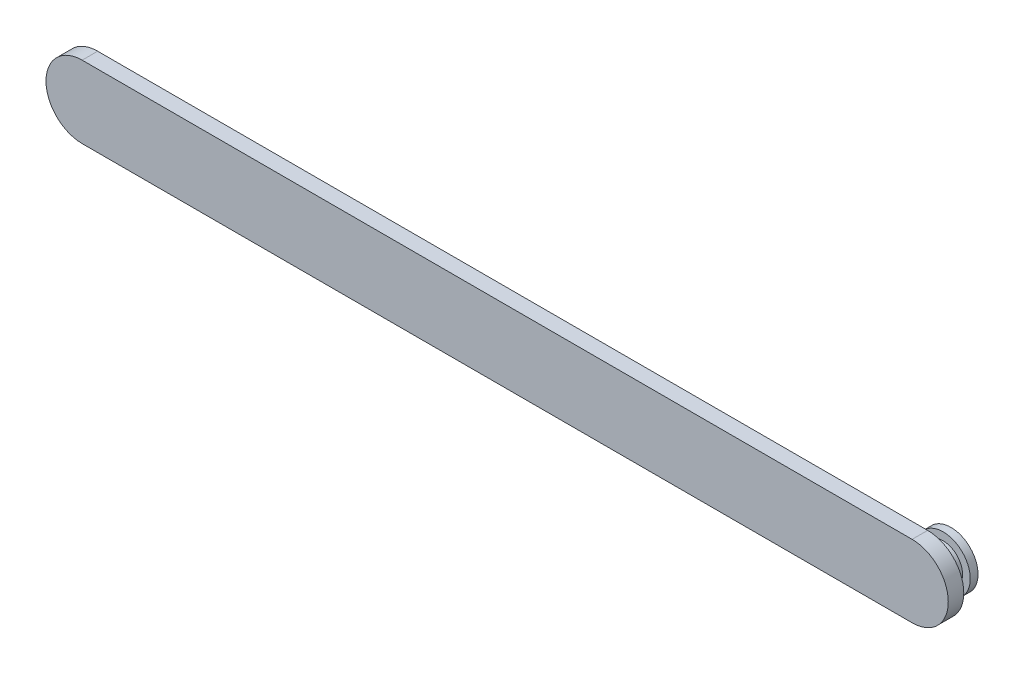
from build123d import *

# Parameters (mm, degrees)
BOSS_EXTRUDE1_DEPTH = 2.54
SKETCH2_R           = 3.175
BOSS_EXTRUDE2_DEPTH = 2.54
SKETCH3_R           = 4.445
BOSS_EXTRUDE3_DEPTH = 1.27


with BuildPart() as part:
    # Sketch1 → Boss-Extrude1 (new body)
    with BuildSketch(Plane.XY):
        with BuildLine():
            Line((0, 5.9182), (135.89, 5.9182))
            ThreePointArc((135.89, 5.9182), (141.8082, 0), (135.89, -5.9182))
            Line((135.89, -5.9182), (0, -5.9182))
            ThreePointArc((0, -5.9182), (-5.9182, 0), (0, 5.9182))
        make_face()
    extrude(amount=BOSS_EXTRUDE1_DEPTH)

    # Sketch2 → Boss-Extrude2 (add)
    with BuildSketch(Plane(origin=(0, 0, 0), x_dir=(-1, 0, 0), z_dir=(0, 0, -1))):
        with Locations((-135.89, 0)):
            Circle(SKETCH2_R)
    extrude(amount=BOSS_EXTRUDE2_DEPTH)

    # Sketch3 → Boss-Extrude3 (add)
    with BuildSketch(Plane(origin=(0, 0, -2.54), x_dir=(-1, 0, 0), z_dir=(0, 0, -1))):
        with Locations((-135.89, 0)):
            Circle(SKETCH3_R)
    extrude(amount=BOSS_EXTRUDE3_DEPTH)


solid = part.part
